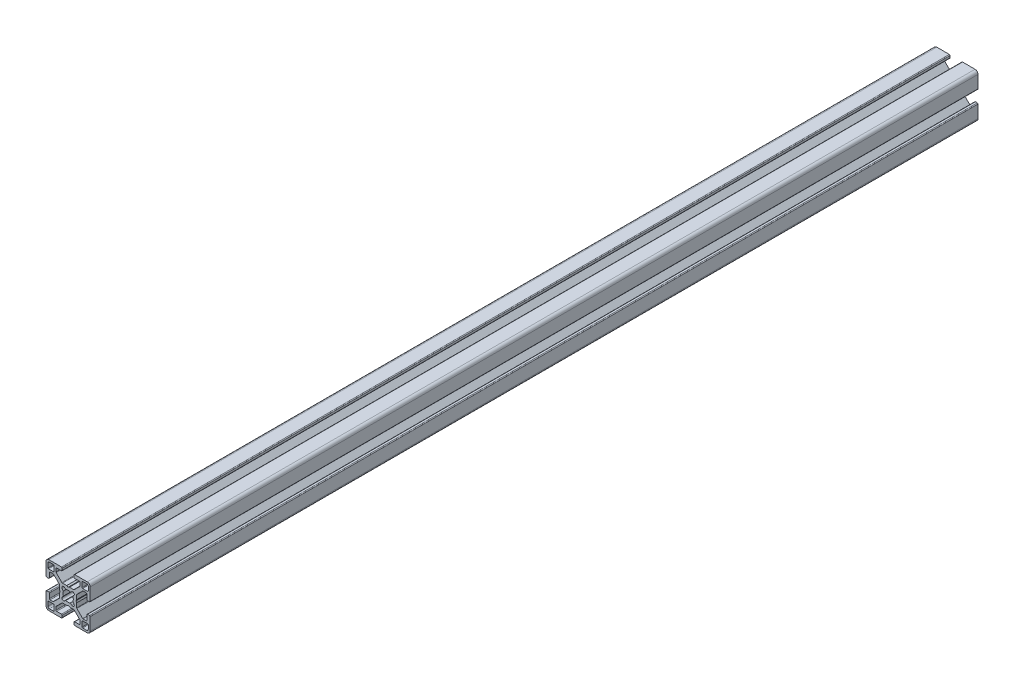
from build123d import *

# Parameters (mm, degrees)
EXTRUSION1_DEPTH = 603


with BuildPart() as part:
    # Esboço1 → Extrusion1 (new body)
    with BuildSketch(Plane.XY):
        with BuildLine():
            ThreePointArc((-15, -13), (-14.414213562, -14.414213562), (-13, -15))
            Line((-13, -15), (-4.508, -15))
            ThreePointArc((-4.508, -15), (-4.148789755, -14.851210245), (-4, -14.492))
            Line((-4, -14.492), (-4, -13.251))
            ThreePointArc((-4, -13.251), (-4.148789755, -12.891789755), (-4.508, -12.743))
            Line((-4.508, -12.743), (-7.742, -12.743))
            ThreePointArc((-7.742, -12.743), (-8.101210245, -12.594210245), (-8.25, -12.235))
            Line((-8.25, -12.235), (-8.25, -10.264165074))
            ThreePointArc((-8.25, -10.264165074), (-8.211330803, -10.06976189), (-8.101210245, -9.904954829))
            Line((-8.101210245, -9.904954829), (-4.179545171, -5.983289755))
            ThreePointArc((-4.179545171, -5.983289755), (-4.01473811, -5.873169197), (-3.820334926, -5.8345))
            Line((-3.820334926, -5.8345), (-0.949019985, -5.8345))
            Line((-0.949019985, -5.8345), (0, -5.325))
            Line((0, -5.325), (0.949019985, -5.8345))
            Line((0.949019985, -5.8345), (3.82157951, -5.8345))
            ThreePointArc((3.82157951, -5.8345), (4.015982694, -5.873169197), (4.180789755, -5.983289755))
            Line((4.180789755, -5.983289755), (8.101210245, -9.903710245))
            ThreePointArc((8.101210245, -9.903710245), (8.211330803, -10.068517306), (8.25, -10.26292049))
            Line((8.25, -10.26292049), (8.25, -12.235))
            ThreePointArc((8.25, -12.235), (8.101210245, -12.594210245), (7.742, -12.743))
            Line((7.742, -12.743), (4.508, -12.743))
            ThreePointArc((4.508, -12.743), (4.148789755, -12.891789755), (4, -13.251))
            Line((4, -13.251), (4, -14.492))
            ThreePointArc((4, -14.492), (4.148789755, -14.851210245), (4.508, -15))
            Line((4.508, -15), (13, -15))
            ThreePointArc((13, -15), (14.414213562, -14.414213562), (15, -13))
            Line((15, -13), (15, -4.508))
            ThreePointArc((15, -4.508), (14.851210245, -4.148789755), (14.492, -4))
            Line((14.492, -4), (13.251, -4))
            ThreePointArc((13.251, -4), (12.891789755, -4.148789755), (12.743, -4.508))
            Line((12.743, -4.508), (12.743, -7.742))
            ThreePointArc((12.743, -7.742), (12.594210245, -8.101210245), (12.235, -8.25))
            Line((12.235, -8.25), (10.264165074, -8.25))
            ThreePointArc((10.264165074, -8.25), (10.06976189, -8.211330803), (9.904954829, -8.101210245))
            Line((9.904954829, -8.101210245), (5.983289755, -4.179545171))
            ThreePointArc((5.983289755, -4.179545171), (5.873169197, -4.01473811), (5.8345, -3.820334926))
            Line((5.8345, -3.820334926), (5.8345, -0.949019985))
            Line((5.8345, -0.949019985), (5.325, 0))
            Line((5.325, 0), (5.8345, 0.949019985))
            Line((5.8345, 0.949019985), (5.8345, 3.82157951))
            ThreePointArc((5.8345, 3.82157951), (5.873169197, 4.015982694), (5.983289755, 4.180789755))
            Line((5.983289755, 4.180789755), (9.903710245, 8.101210245))
            ThreePointArc((9.903710245, 8.101210245), (10.068517306, 8.211330803), (10.26292049, 8.25))
            Line((10.26292049, 8.25), (12.235, 8.25))
            ThreePointArc((12.235, 8.25), (12.594210245, 8.101210245), (12.743, 7.742))
            Line((12.743, 7.742), (12.743, 4.508))
            ThreePointArc((12.743, 4.508), (12.891789755, 4.148789755), (13.251, 4))
            Line((13.251, 4), (14.492, 4))
            ThreePointArc((14.492, 4), (14.851210245, 4.148789755), (15, 4.508))
            Line((15, 4.508), (15, 13))
            ThreePointArc((15, 13), (14.414213562, 14.414213562), (13, 15))
            Line((13, 15), (4.508, 15))
            ThreePointArc((4.508, 15), (4.148789755, 14.851210245), (4, 14.492))
            Line((4, 14.492), (4, 13.251))
            ThreePointArc((4, 13.251), (4.148789755, 12.891789755), (4.508, 12.743))
            Line((4.508, 12.743), (7.742, 12.743))
            ThreePointArc((7.742, 12.743), (8.101210245, 12.594210245), (8.25, 12.235))
            Line((8.25, 12.235), (8.25, 10.264165074))
            ThreePointArc((8.25, 10.264165074), (8.211330803, 10.06976189), (8.101210245, 9.904954829))
            Line((8.101210245, 9.904954829), (4.179545171, 5.983289755))
            ThreePointArc((4.179545171, 5.983289755), (4.01473811, 5.873169197), (3.820334926, 5.8345))
            Line((3.820334926, 5.8345), (0.949019985, 5.8345))
            Line((0.949019985, 5.8345), (0, 5.325))
            Line((0, 5.325), (-0.949019985, 5.8345))
            Line((-0.949019985, 5.8345), (-3.82157951, 5.8345))
            ThreePointArc((-3.82157951, 5.8345), (-4.015982694, 5.873169197), (-4.180789755, 5.983289755))
            Line((-4.180789755, 5.983289755), (-8.101210245, 9.903710245))
            ThreePointArc((-8.101210245, 9.903710245), (-8.211330803, 10.068517306), (-8.25, 10.26292049))
            Line((-8.25, 10.26292049), (-8.25, 12.235))
            ThreePointArc((-8.25, 12.235), (-8.101210245, 12.594210245), (-7.742, 12.743))
            Line((-7.742, 12.743), (-4.508, 12.743))
            ThreePointArc((-4.508, 12.743), (-4.148789755, 12.891789755), (-4, 13.251))
            Line((-4, 13.251), (-4, 14.492))
            ThreePointArc((-4, 14.492), (-4.148789755, 14.851210245), (-4.508, 15))
            Line((-4.508, 15), (-13, 15))
            ThreePointArc((-13, 15), (-14.414213562, 14.414213562), (-15, 13))
            Line((-15, 13), (-15, 4.508))
            ThreePointArc((-15, 4.508), (-14.851210245, 4.148789755), (-14.492, 4))
            Line((-14.492, 4), (-13.251, 4))
            ThreePointArc((-13.251, 4), (-12.891789755, 4.148789755), (-12.743, 4.508))
            Line((-12.743, 4.508), (-12.743, 7.742))
            ThreePointArc((-12.743, 7.742), (-12.594210245, 8.101210245), (-12.235, 8.25))
            Line((-12.235, 8.25), (-10.264165074, 8.25))
            ThreePointArc((-10.264165074, 8.25), (-10.06976189, 8.211330803), (-9.904954829, 8.101210245))
            Line((-9.904954829, 8.101210245), (-5.983289755, 4.179545171))
            ThreePointArc((-5.983289755, 4.179545171), (-5.873169197, 4.01473811), (-5.8345, 3.820334926))
            Line((-5.8345, 3.820334926), (-5.8345, 0.949019985))
            Line((-5.8345, 0.949019985), (-5.325, 0))
            Line((-5.325, 0), (-5.8345, -0.949019985))
            Line((-5.8345, -0.949019985), (-5.8345, -3.82157951))
            ThreePointArc((-5.8345, -3.82157951), (-5.873169197, -4.015982694), (-5.983289755, -4.180789755))
            Line((-5.983289755, -4.180789755), (-9.903710245, -8.101210245))
            ThreePointArc((-9.903710245, -8.101210245), (-10.068517306, -8.211330803), (-10.26292049, -8.25))
            Line((-10.26292049, -8.25), (-12.235, -8.25))
            ThreePointArc((-12.235, -8.25), (-12.594210245, -8.101210245), (-12.743, -7.742))
            Line((-12.743, -7.742), (-12.743, -4.508))
            ThreePointArc((-12.743, -4.508), (-12.891789755, -4.148789755), (-13.251, -4))
            Line((-13.251, -4), (-14.492, -4))
            ThreePointArc((-14.492, -4), (-14.851210245, -4.148789755), (-15, -4.508))
            Line((-15, -4.508), (-15, -13))
        make_face()
        with BuildLine():
            Line((-13.7, -12.7), (-13.7, -9.881))
            ThreePointArc((-13.7, -9.881), (-13.588407684, -9.611592316), (-13.319, -9.5))
            Line((-13.319, -9.5), (-9.881, -9.5))
            ThreePointArc((-9.881, -9.5), (-9.611592316, -9.611592316), (-9.5, -9.881))
            Line((-9.5, -9.881), (-9.5, -13.319))
            ThreePointArc((-9.5, -13.319), (-9.611592316, -13.588407684), (-9.881, -13.7))
            Line((-9.881, -13.7), (-12.7, -13.7))
            ThreePointArc((-12.7, -13.7), (-13.407106781, -13.407106781), (-13.7, -12.7))
        make_face(mode=Mode.SUBTRACT)
        with BuildLine():
            Line((9.5, -13.319), (9.5, -9.881))
            ThreePointArc((9.5, -9.881), (9.611592316, -9.611592316), (9.881, -9.5))
            Line((9.881, -9.5), (13.319, -9.5))
            ThreePointArc((13.319, -9.5), (13.588407684, -9.611592316), (13.7, -9.881))
            Line((13.7, -9.881), (13.7, -12.7))
            ThreePointArc((13.7, -12.7), (13.407106781, -13.407106781), (12.7, -13.7))
            Line((12.7, -13.7), (9.881, -13.7))
            ThreePointArc((9.881, -13.7), (9.611592316, -13.588407684), (9.5, -13.319))
        make_face(mode=Mode.SUBTRACT)
        with BuildLine():
            Line((-13.7, 9.881), (-13.7, 12.7))
            ThreePointArc((-13.7, 12.7), (-13.407106781, 13.407106781), (-12.7, 13.7))
            Line((-12.7, 13.7), (-9.881, 13.7))
            ThreePointArc((-9.881, 13.7), (-9.611592316, 13.588407684), (-9.5, 13.319))
            Line((-9.5, 13.319), (-9.5, 9.881))
            ThreePointArc((-9.5, 9.881), (-9.611592316, 9.611592316), (-9.881, 9.5))
            Line((-9.881, 9.5), (-13.319, 9.5))
            ThreePointArc((-13.319, 9.5), (-13.588407684, 9.611592316), (-13.7, 9.881))
        make_face(mode=Mode.SUBTRACT)
        with BuildLine():
            Line((-3.198163609, 1.494205317), (-4.010726841, 2.5139095))
            ThreePointArc((-4.010726841, 2.5139095), (-3.900018469, 3.900018469), (-2.5139095, 4.010726841))
            Line((-2.5139095, 4.010726841), (-1.494205317, 3.198163609))
            ThreePointArc((-1.494205317, 3.198163609), (0, 3.53), (1.494205317, 3.198163609))
            Line((1.494205317, 3.198163609), (2.5139095, 4.010726841))
            ThreePointArc((2.5139095, 4.010726841), (3.900018469, 3.900018469), (4.010726841, 2.5139095))
            Line((4.010726841, 2.5139095), (3.198163609, 1.494205317))
            ThreePointArc((3.198163609, 1.494205317), (3.53, 0), (3.198163609, -1.494205317))
            Line((3.198163609, -1.494205317), (4.010726841, -2.5139095))
            ThreePointArc((4.010726841, -2.5139095), (3.900018469, -3.900018469), (2.5139095, -4.010726841))
            Line((2.5139095, -4.010726841), (1.494205317, -3.198163609))
            ThreePointArc((1.494205317, -3.198163609), (0, -3.53), (-1.494205317, -3.198163609))
            Line((-1.494205317, -3.198163609), (-2.5139095, -4.010726841))
            ThreePointArc((-2.5139095, -4.010726841), (-3.900018469, -3.900018469), (-4.010726841, -2.5139095))
            Line((-4.010726841, -2.5139095), (-3.198163609, -1.494205317))
            ThreePointArc((-3.198163609, -1.494205317), (-3.53, 0), (-3.198163609, 1.494205317))
        make_face(mode=Mode.SUBTRACT)
        with BuildLine():
            Line((9.5, 9.881), (9.5, 13.319))
            ThreePointArc((9.5, 13.319), (9.611592316, 13.588407684), (9.881, 13.7))
            Line((9.881, 13.7), (12.7, 13.7))
            ThreePointArc((12.7, 13.7), (13.407106781, 13.407106781), (13.7, 12.7))
            Line((13.7, 12.7), (13.7, 9.881))
            ThreePointArc((13.7, 9.881), (13.588407684, 9.611592316), (13.319, 9.5))
            Line((13.319, 9.5), (9.881, 9.5))
            ThreePointArc((9.881, 9.5), (9.611592316, 9.611592316), (9.5, 9.881))
        make_face(mode=Mode.SUBTRACT)
    extrude(amount=-EXTRUSION1_DEPTH)


solid = part.part
